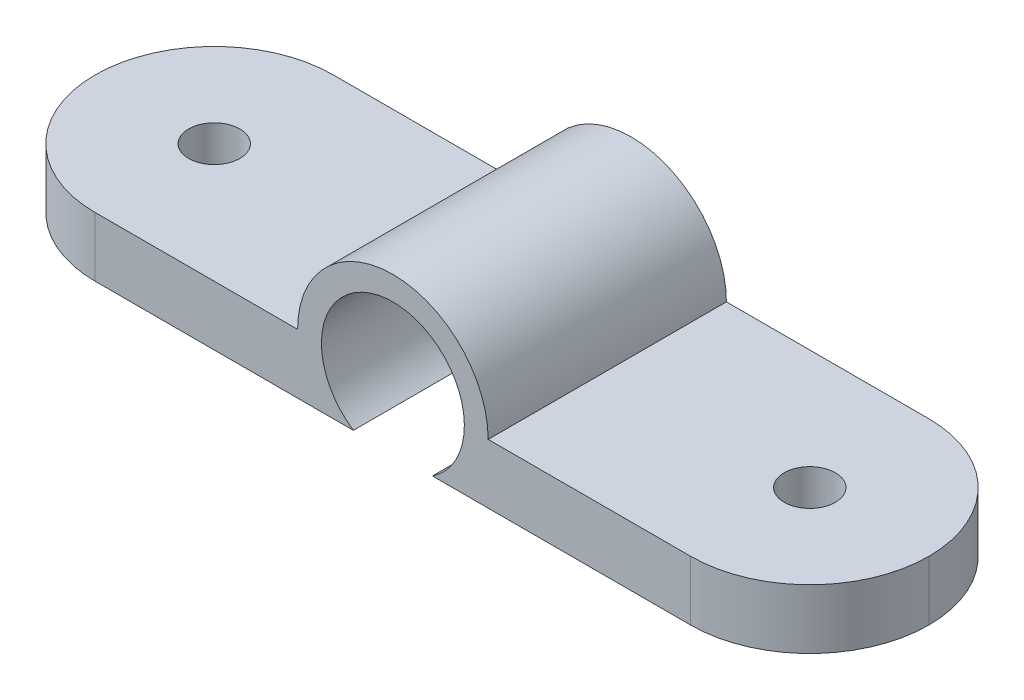
from build123d import *

# Parameters (mm, degrees)
SKETCH1_W           = 70
SKETCH1_H           = 20
BOSS_EXTRUDE1_DEPTH = 5
FILLET1_R           = 10
SKETCH2_R           = 2.15
CUT_EXTRUDE1_DEPTH  = 10
BOSS_EXTRUDE2_DEPTH = 20
SKETCH6_R           = 6
CUT_EXTRUDE3_DEPTH  = 20


with BuildPart() as part:
    # Sketch1 → Boss-Extrude1 (new body)
    with BuildSketch(Plane(origin=(0, 0, 0), x_dir=(1, 0, 0), z_dir=(0, 1, 0))):
        with Locations((-22.239915074, 10)):
            Rectangle(SKETCH1_W, SKETCH1_H)
    extrude(amount=BOSS_EXTRUDE1_DEPTH)

    # Fillet1
    fillet1_edges = [part.edges().sort_by_distance(p)[0] for p in [
        (12.760084926, 2.5, 0),
        (12.760084926, 2.5, -20),
        (-57.239915074, 2.5, 0),
        (-57.239915074, 2.5, -20),
    ]]
    fillet(fillet1_edges, radius=FILLET1_R - 0.0001)  # a hair under: the kernel refuses the full size

    # Sketch2 → Cut-Extrude1 (cut)
    with BuildSketch(Plane(origin=(0, 5, 0), x_dir=(1, 0, 0), z_dir=(0, 1, 0))):
        with Locations(Location((-47.239915074, 10, 0), (0, 0, 270))):
            Circle(SKETCH2_R)
        with Locations(Location((2.760084926, 10, 0), (0, 0, 270))):
            Circle(SKETCH2_R)
    extrude(amount=-CUT_EXTRUDE1_DEPTH, mode=Mode.SUBTRACT)

    # Sketch3 → Boss-Extrude2 (add)
    with BuildSketch(Plane(origin=(0, 0, -20), x_dir=(-1, 0, 0), z_dir=(0, 0, -1))):
        with BuildLine():
            Line((14.239915074, 5), (30.239915074, 5))
            ThreePointArc((30.239915074, 5), (22.239915074, 13), (14.239915074, 5))
        make_face()
    extrude(amount=-BOSS_EXTRUDE2_DEPTH)

    # Sketch6 → Cut-Extrude3 (cut)
    with BuildSketch(Plane(origin=(0, 0, -20), x_dir=(-1, 0, 0), z_dir=(0, 0, -1))):
        with Locations((22.239915074, 5)):
            Circle(SKETCH6_R)
    extrude(amount=-CUT_EXTRUDE3_DEPTH, mode=Mode.SUBTRACT)


solid = part.part
